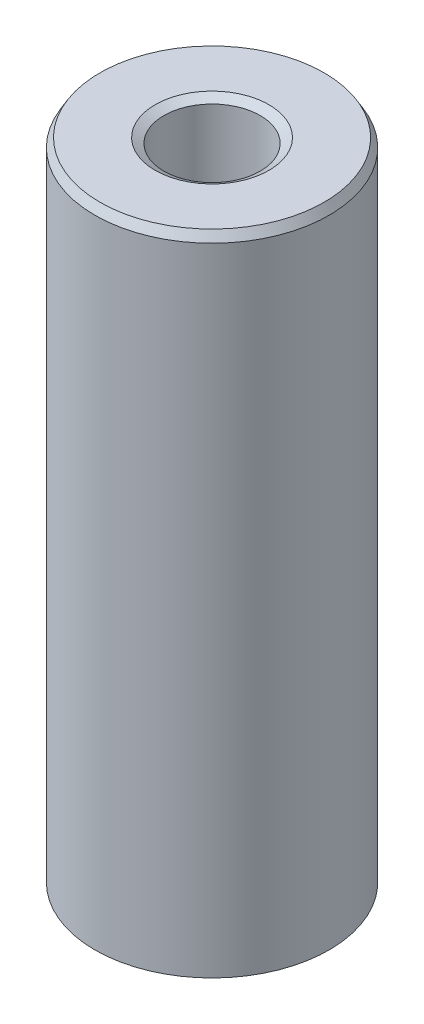
from build123d import *
from OCP.BRepFilletAPI import BRepFilletAPI_MakeChamfer

# Parameters (mm, degrees)
SKETCH1_R           = 52.5
BOSS_EXTRUDE1_DEPTH = 291.279777192
SKETCH2_R           = 21.588656105
CUT_EXTRUDE1_DEPTH  = 301.593427408
CHAMFER1_SIZE       = 3.908792281
CHAMFER1_SIZE2      = 2.256742276


with BuildPart() as part:
    # Sketch1 → Boss-Extrude1 (new body)
    with BuildSketch(Plane(origin=(0, 0, 0), x_dir=(1, 0, 0), z_dir=(0, 1, 0))):
        Circle(SKETCH1_R)
    extrude(amount=BOSS_EXTRUDE1_DEPTH)

    # Sketch2 → Cut-Extrude1 (cut, through all)
    with BuildSketch(Plane(origin=(0, 0, 0), x_dir=(1, 0, 0), z_dir=(0, 1, 0))):
        Circle(SKETCH2_R)
    extrude(amount=CUT_EXTRUDE1_DEPTH, mode=Mode.SUBTRACT)

    # Chamfer1: one chamfer whose edges measure the first distance from different faces: ONE call of the kernel's chamfer builder (chamfer() names one face for all edges)
    chamfer1_edges_1 = [part.edges().sort_by_distance(p)[0] for p in [
        (-21.588656105, 291.279777192, 0),
    ]]
    chamfer1_side_1 = [part.faces().sort_by_distance(p)[0] for p in [
        (-51.01507576, 291.279777192, 0),
    ]]
    chamfer1_edges_2 = [part.edges().sort_by_distance(p)[0] for p in [
        (-21.588656105, 0, 0),
    ]]
    chamfer1_side_2 = [part.faces().sort_by_distance(p)[0] for p in [
        (-21.588656105, 145.639888596, 0),
    ]]
    chamfer1_edges_3 = [part.edges().sort_by_distance(p)[0] for p in [
        (-52.5, 0, 0),
    ]]
    chamfer1_side_3 = [part.faces().sort_by_distance(p)[0] for p in [
        (-51.01507576, 0, 0),
    ]]
    chamfer1_edges_4 = [part.edges().sort_by_distance(p)[0] for p in [
        (-52.5, 291.279777192, 0),
    ]]
    chamfer1_side_4 = [part.faces().sort_by_distance(p)[0] for p in [
        (-52.5, 145.639888596, 0),
    ]]
    chamfer1 = BRepFilletAPI_MakeChamfer(part.part.solid().wrapped)
    for e in chamfer1_edges_1:
        chamfer1.Add(CHAMFER1_SIZE, CHAMFER1_SIZE2, e.wrapped, chamfer1_side_1[0].wrapped)  # the first distance lies on this face
    for e in chamfer1_edges_2:
        chamfer1.Add(CHAMFER1_SIZE, CHAMFER1_SIZE2, e.wrapped, chamfer1_side_2[0].wrapped)  # the first distance lies on this face
    for e in chamfer1_edges_3:
        chamfer1.Add(CHAMFER1_SIZE, CHAMFER1_SIZE2, e.wrapped, chamfer1_side_3[0].wrapped)  # the first distance lies on this face
    for e in chamfer1_edges_4:
        chamfer1.Add(CHAMFER1_SIZE, CHAMFER1_SIZE2, e.wrapped, chamfer1_side_4[0].wrapped)  # the first distance lies on this face
    add(Compound.cast(chamfer1.Shape()), mode=Mode.REPLACE)


solid = part.part
